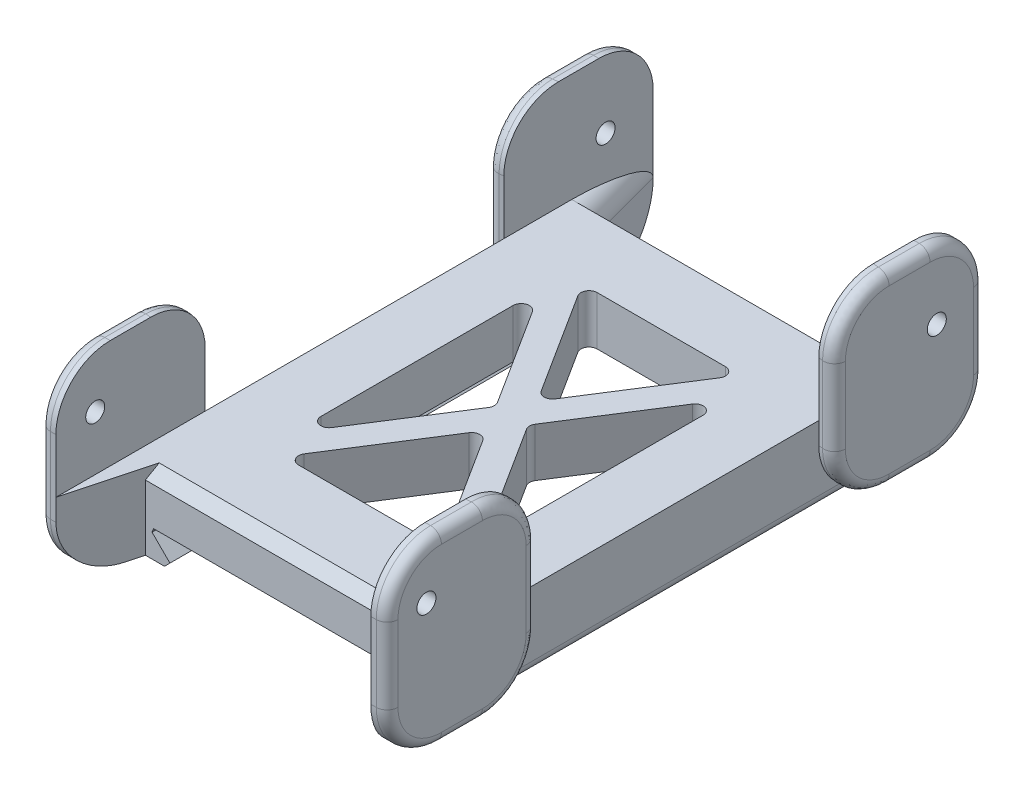
from build123d import *
from OCP.BRepFilletAPI import BRepFilletAPI_MakeChamfer

# Parameters (mm, degrees)
BOSS_EXTRUDE1_DEPTH = 80
CHAMFER1_SIZE       = 2
CHAMFER1_SIZE2      = 1.4142135623730976
BOSS_EXTRUDE2_DEPTH = 4
CHAMFER2_SIZE       = 2
BOSS_EXTRUDE4_START = -14
BOSS_EXTRUDE4_DEPTH = 34
SKETCH8_R           = 1.7500000000000029
SKETCH8_R_2         = 1.749999999999997
CUT_EXTRUDE2_DEPTH  = 117.55899793666725
CUT_EXTRUDE3_DEPTH  = 101.36433629531959
FILLET1_R           = 1.5
FILLET16_R          = 2
CUT_EXTRUDE4_DEPTH  = 20
FILLET17_R          = 10
FILLET18_R          = 2
FILLET19_R          = 4


with BuildPart() as part:
    # Sketch1 → Boss-Extrude1 (new body)
    with BuildSketch(Plane.XY):
        Polygon((-24.292893218813447, -0.7071067811865398), (-24, 0), (24, 0), (24.292893218813447, -0.7071067811865398), (19.99999999999988, -5.000000000000001), (25, -5), (25, 5), (-25, 5), (-25, -5), (-19.99999999999988, -5), align=None)
        Polygon((-29, -5.000000000000001), (-25, -5), (-25, 5), (25, 5), (25, -5), (29, -5.000000000000001), (29, 9.000000000000002), (-29, 9.000000000000002), align=None)
    extrude(amount=BOSS_EXTRUDE1_DEPTH)

    # Chamfer1: one chamfer whose edges measure the first distance from different faces: ONE call of the kernel's chamfer builder (chamfer() names one face for all edges)
    chamfer1_edges_1 = [part.edges().sort_by_distance(p)[0] for p in [
        (19.99999999999988, -5, 40),
    ]]
    chamfer1_side_1 = [part.faces().sort_by_distance(p)[0] for p in [
        (22.146446609406663, -2.8535533905932704, 40),
    ]]
    chamfer1_edges_2 = [part.edges().sort_by_distance(p)[0] for p in [
        (-19.99999999999988, -5, 40),
    ]]
    chamfer1_side_2 = [part.faces().sort_by_distance(p)[0] for p in [
        (-24.49999999999994, -5, 40),
    ]]
    chamfer1 = BRepFilletAPI_MakeChamfer(part.part.solid().wrapped)
    for e in chamfer1_edges_1:
        chamfer1.Add(CHAMFER1_SIZE, CHAMFER1_SIZE2, e.wrapped, chamfer1_side_1[0].wrapped)  # the first distance lies on this face
    for e in chamfer1_edges_2:
        chamfer1.Add(CHAMFER1_SIZE, CHAMFER1_SIZE2, e.wrapped, chamfer1_side_2[0].wrapped)  # the first distance lies on this face
    add(Compound.cast(chamfer1.Shape()), mode=Mode.REPLACE)

    # Sketch3 → Boss-Extrude2 (add)
    with BuildSketch(Plane(origin=(0, 0, 0), x_dir=(-1, 0, 0), z_dir=(0, 0, -1))):
        Polygon((-29, 9.000000000000002), (28.999999999999993, 9.000000000000002), (29, -5.000000000000001), (-29, -5.000000000000001), align=None)
    extrude(amount=BOSS_EXTRUDE2_DEPTH)

    # Chamfer2
    chamfer2_edges = [part.edges().sort_by_distance(p)[0] for p in [
        (0, 9.000000000000002, 80),
        (0, -5.000000000000001, -4),
        (-28.999999999999996, 2, -4),
        (3.55e-15, 9.000000000000002, -4),
    ]]
    chamfer(chamfer2_edges, length=CHAMFER2_SIZE)

    # Sketch6 → Boss-Extrude4 (add)
    with BuildSketch(Plane(origin=(0, 9.000000000000002, 0), x_dir=(1, 0, 0), z_dir=(0, 1, 0)).offset(BOSS_EXTRUDE4_START)):
        Polygon((28.999999999999996, -10.500000000000012), (31.999999999999986, -10.827272727272735), (31.999999999999986, 17), (28.99999999999999, 16.999999999999986), (28.999999999999993, 1.9999999999999858), align=None)
        Polygon((28.999999999999993, 1.9999999999999858), (28.99999999999999, 16.999999999999986), (27.273253634424695, 10.55569483188789), (26.339905107309647, 1.9999999999999911), align=None)
        Polygon((26.339905107309647, 1.9999999999999911), (27.273253634424687, 10.555694831887891), (24.98076211353327, 1.999999999999984), align=None)
        Polygon((-26.33990510730964, 1.999999999999988), (-24.980762113533274, 1.999999999999988), (-27.273253634424673, 10.555694831887777), align=None)
        Polygon((-26.33990510730965, 1.9999999999999876), (-27.273253634424677, 10.555694831887777), (-29, 16.999999999999975), (-29, 1.9999999999999858), align=None)
        Polygon((-29, 1.9999999999999858), (-29, 16.99999999999997), (-31.999999999999986, 16.999999999999993), (-31.999999999999986, -10.827272727272742), (-29, -10.500000000000009), align=None)
        Polygon((27.27325363442468, -86.55569483188785), (26.33990510730965, -78.00000000000004), (24.980762113533288, -78.00000000000004), align=None)
        Polygon((28.99999999999999, -93.00000000000001), (28.999999999999993, -78.00000000000004), (26.339905107309647, -78.00000000000004), (27.27325363442468, -86.55569483188785), align=None)
        Polygon((31.999999999999986, -93.00000000000003), (31.999999999999986, -65.1727272727273), (28.999999999999996, -65.50000000000003), (28.999999999999993, -78.00000000000004), (28.99999999999999, -93.00000000000001), align=None)
        Polygon((-31.999999999999986, -93.00000000000003), (-29, -93), (-29, -78.00000000000004), (-29, -65.50000000000003), (-31.999999999999986, -65.1727272727273), align=None)
        Polygon((-29, -93), (-27.27325363442467, -86.55569483188779), (-26.33990510730965, -78.00000000000004), (-29, -78.00000000000004), align=None)
        Polygon((-27.27325363442467, -86.55569483188779), (-24.98076211353327, -78.00000000000001), (-26.33990510730965, -78.00000000000004), align=None)
    extrude(amount=BOSS_EXTRUDE4_DEPTH)

    # Sketch8 → Cut-Extrude2 (cut, through all)
    with BuildSketch(Plane.ZY.offset(31.999999999999986)):
        with Locations((-8.234822599597958, 16.476421144860893)):
            Circle(SKETCH8_R)
        with Locations((85.76096581557758, 19.000000000000128)):
            Circle(SKETCH8_R_2)
    extrude(amount=-CUT_EXTRUDE2_DEPTH, mode=Mode.SUBTRACT)

    # Sketch9 → Cut-Extrude3 (cut, through all)
    with BuildSketch(Plane(origin=(0, 9.000000000000002, 0), x_dir=(1, 0, 0), z_dir=(0, 1, 0))):
        with BuildLine():
            Line((14.734507768401814, -19.502346653370523), (2.9632738205466698, -38.00000000000003))
            Line((2.963273820546666, -38.00000000000003), (14.734507768401839, -56.49765334662959))
            ThreePointArc((14.734507768401842, -56.49765334662959), (16.419381480637153, -57.132520365703066), (17.50000000000004, -55.69234010833984))
            Line((17.50000000000004, -55.69234010833984), (17.50000000000001, -20.307659891660272))
            ThreePointArc((17.500000000000014, -20.307659891660272), (16.419381480637128, -18.867479634297048), (14.734507768401818, -19.502346653370523))
        make_face()
        with BuildLine():
            Line((13.06970866417807, -63.19468676171028), (1.954e-14, -42.65657314657334))
            Line((5.81e-15, -42.65657314657334), (8.78e-15, -65.50000000000003))
            Line((8.88e-15, -65.50000000000003), (11.804216432579896, -65.50000000000003))
            ThreePointArc((11.804216432579897, -65.50000000000003), (13.119125147554948, -64.72181373724995), (13.069708664178068, -63.19468676171028))
        make_face()
        with BuildLine():
            Line((8.78e-15, -65.50000000000003), (5.81e-15, -42.65657314657334))
            Line((1.066e-14, -42.65657314657335), (-13.06970866417804, -63.19468676171028))
            ThreePointArc((-13.06970866417804, -63.19468676171028), (-13.119125147554922, -64.72181373724995), (-11.804216432579867, -65.50000000000003))
            Line((-11.804216432579867, -65.50000000000003), (8.88e-15, -65.50000000000003))
        make_face()
        with BuildLine():
            Line((-14.734507768401803, -56.49765334662955), (-2.9632738205466413, -38.000000000000014))
            Line((-2.963273820546643, -38.000000000000014), (-14.734507768401798, -19.502346653370488))
            ThreePointArc((-14.734507768401798, -19.502346653370488), (-16.41938148063711, -18.867479634297005), (-17.499999999999996, -20.307659891660236))
            Line((-17.499999999999996, -20.307659891660236), (-17.5, -55.6923401083398))
            ThreePointArc((-17.500000000000004, -55.6923401083398), (-16.419381480637117, -57.13252036570303), (-14.734507768401802, -56.497653346629555))
        make_face()
        with BuildLine():
            Line((4.6e-15, -33.343426853426706), (1.63e-15, -10.50000000000003))
            Line((1.78e-15, -10.50000000000003), (-11.804216432579855, -10.50000000000003))
            ThreePointArc((-11.804216432579855, -10.500000000000028), (-13.119125147554914, -11.278186262750111), (-13.069708664178023, -12.805313238289788))
            Line((-13.069708664178025, -12.805313238289788), (7.11e-15, -33.343426853426706))
        make_face()
        with BuildLine():
            Line((11.804216432579887, -10.50000000000003), (1.78e-15, -10.50000000000003))
            Line((1.63e-15, -10.50000000000003), (4.6e-15, -33.343426853426706))
            Line((1.066e-14, -33.343426853426706), (13.069708664178057, -12.805313238289788))
            ThreePointArc((13.069708664178055, -12.805313238289788), (13.119125147554945, -11.278186262750111), (11.804216432579887, -10.500000000000028))
        make_face()
    extrude(amount=-CUT_EXTRUDE3_DEPTH, mode=Mode.SUBTRACT)

    # Fillet1
    fillet1_edges = [part.edges().sort_by_distance(p)[0] for p in [
        (-2.9632738205466422, 4.500000000000001, 38.000000000000014),
        (1.267e-14, 4.500000000000001, 42.65657314657334),
        (5.85e-15, 4.500000000000001, 33.343426853426706),
        (2.963273820546668, 4.500000000000001, 38.00000000000003),
    ]]
    fillet(fillet1_edges, radius=FILLET1_R)

    # Fillet16
    fillet16_edges = [part.edges().sort_by_distance(p)[0] for p in [
        (29, -5.000000000000001, 38.00000000000002),
        (-29, -5.000000000000001, 38.00000000000002),
    ]]
    fillet(fillet16_edges, radius=FILLET16_R)

    # Sketch11 → Cut-Extrude4 (cut)
    with BuildSketch(Plane(origin=(0, 29, 0), x_dir=(1, 0, 0), z_dir=(0, 1, 0))):
        Polygon((24.98076211353327, 1.9999999999999862), (28.99999999999999, 16.999999999999986), (29, 1.999999999999988), align=None)
        Polygon((-28.999999999999993, 16.999999999999975), (-29, 1.9999999999999805), (-24.98076211353327, 1.9999999999999796), align=None)
        Polygon((-29, -78.00000000000003), (-24.98076211353327, -78.00000000000003), (-28.999999999999993, -93.00000000000001), align=None)
        Polygon((29, -78.00000000000003), (24.98076211353327, -78.00000000000003), (28.99999999999999, -93.00000000000003), align=None)
    extrude(amount=-CUT_EXTRUDE4_DEPTH, mode=Mode.SUBTRACT)

    # Fillet17
    fillet17_edges = [part.edges().sort_by_distance(p)[0] for p in [
        (30.499999999999993, 29, 10.663636363636375),
    ]]
    fillet(fillet17_edges, radius=FILLET17_R)
    fillet17_2_edges = [part.edges().sort_by_distance(p)[0] for p in [
        (29.499999999999993, -5, 10.554545454545467),
    ]]
    fillet(fillet17_2_edges, radius=FILLET17_R)
    fillet17_3_edges = [part.edges().sort_by_distance(p)[0] for p in [
        (29.499999999999993, -5, 65.44545454545458),
    ]]
    fillet(fillet17_3_edges, radius=FILLET17_R)
    fillet17_4_edges = [part.edges().sort_by_distance(p)[0] for p in [
        (30.499999999999986, -4.999999999999998, 93.00000000000001),
    ]]
    fillet(fillet17_4_edges, radius=FILLET17_R)
    fillet17_5_edges = [part.edges().sort_by_distance(p)[0] for p in [
        (-30.499999999999993, -4.999999999999998, 93.00000000000001),
    ]]
    fillet(fillet17_5_edges, radius=FILLET17_R)
    fillet17_6_edges = [part.edges().sort_by_distance(p)[0] for p in [
        (-29.499999999999993, -5, 65.44545454545458),
    ]]
    fillet(fillet17_6_edges, radius=FILLET17_R)
    fillet17_7_edges = [part.edges().sort_by_distance(p)[0] for p in [
        (-29.499999999999993, -5, 10.554545454545467),
    ]]
    fillet(fillet17_7_edges, radius=FILLET17_R)
    fillet17_8_edges = [part.edges().sort_by_distance(p)[0] for p in [
        (-30.499999999999993, -4.999999999999998, -16.999999999999986),
    ]]
    fillet(fillet17_8_edges, radius=FILLET17_R)
    fillet17_9_edges = [part.edges().sort_by_distance(p)[0] for p in [
        (30.499999999999986, -4.999999999999998, -16.99999999999999),
    ]]
    fillet(fillet17_9_edges, radius=FILLET17_R)
    fillet17_10_edges = [part.edges().sort_by_distance(p)[0] for p in [
        (30.499999999999986, 29, -16.99999999999999),
    ]]
    fillet(fillet17_10_edges, radius=FILLET17_R)
    fillet17_11_edges = [part.edges().sort_by_distance(p)[0] for p in [
        (-30.499999999999993, 29, -16.999999999999986),
    ]]
    fillet(fillet17_11_edges, radius=FILLET17_R)
    fillet17_12_edges = [part.edges().sort_by_distance(p)[0] for p in [
        (-30.499999999999993, 29, 10.663636363636371),
    ]]
    fillet(fillet17_12_edges, radius=FILLET17_R)
    fillet17_13_edges = [part.edges().sort_by_distance(p)[0] for p in [
        (-30.499999999999993, 29, 65.33636363636367),
    ]]
    fillet(fillet17_13_edges, radius=FILLET17_R)
    fillet17_14_edges = [part.edges().sort_by_distance(p)[0] for p in [
        (-30.499999999999993, 29, 93.00000000000001),
    ]]
    fillet(fillet17_14_edges, radius=FILLET17_R)
    fillet17_15_edges = [part.edges().sort_by_distance(p)[0] for p in [
        (30.499999999999986, 29, 93.00000000000001),
    ]]
    fillet(fillet17_15_edges, radius=FILLET17_R)
    fillet17_16_edges = [part.edges().sort_by_distance(p)[0] for p in [
        (30.499999999999993, 29, 65.33636363636367),
    ]]
    fillet(fillet17_16_edges, radius=FILLET17_R)

    # Fillet18
    fillet18_edges = [part.edges().sort_by_distance(p)[0] for p in [
        (31.999999999999986, -4.999999999999998, 79.11602770677204),
        (-31.999999999999986, -4.999999999999998, 79.11602770677204),
        (-31.999999999999986, -4.999999999999998, -3.1160277067720124),
        (31.999999999999986, -4.999999999999998, -3.116027706772009),
        (-31.999999999999986, 12.000000000000002, 65.17272727272731),
        (-31.999999999999986, 11.999999999999998, 93.00000000000003),
        (-31.999999999999986, 29, 79.11602770677203),
        (-31.99999999999992, 26.071067811865476, 90.0710678118655),
        (-31.99999999999992, -2.07106781186548, 90.0710678118655),
        (-31.999999999999986, 26.08151678314905, 68.12956278921332),
        (-31.999999999999986, -2.0815167831490466, 68.12956278921334),
        (-31.999999999999986, 12.000000000000005, 10.827272727272739),
        (-31.999999999999986, 11.999999999999998, -16.999999999999996),
        (-31.999999999999986, 29, -3.1160277067720124),
        (-31.999999999999943, -2.07106781186548, -14.071067811865468),
        (-31.999999999999943, 26.071067811865476, -14.07106781186547),
        (-31.999999999999986, 26.081516783149052, 7.870437210786693),
        (-31.999999999999986, -2.081516783149044, 7.8704372107866964),
        (31.999999999999986, 11.999999999999998, -16.999999999999996),
        (31.999999999999986, 29, -3.1160277067720124),
        (31.999999999999986, 12.000000000000002, 10.827272727272739),
        (31.999999999999986, -2.0815167831490404, 7.870437210786703),
        (31.999999999999986, 26.081516783149045, 7.8704372107866964),
        (31.999999999999968, 26.071067811865476, -14.07106781186547),
        (31.999999999999968, -2.07106781186548, -14.071067811865468),
        (31.999999999999986, 12.000000000000002, 65.1727272727273),
        (31.999999999999986, 11.999999999999998, 93.00000000000003),
        (31.999999999999986, 29, 79.11602770677204),
        (31.999999999999954, -2.07106781186548, 90.0710678118655),
        (31.999999999999954, 26.071067811865476, 90.07106781186549),
        (31.999999999999986, 26.081516783149052, 68.12956278921334),
        (31.999999999999986, -2.0815167831490484, 68.12956278921334),
    ]]
    fillet(fillet18_edges, radius=FILLET18_R)

    # Fillet19
    # the kernel refuses this fillet: 4 mm, written as the material it takes off along each edge
    with BuildSketch(Plane(origin=(-22.39257166250813, 9.000000000000002, 7.659258262890722), x_dir=(0, -1, 0), z_dir=(-0.25881904510251375, 0, -0.9659258262890702))) as fillet19_piece_1_section:
        with BuildLine():
            CenterArc((FILLET19_R, FILLET19_R), FILLET19_R, 180, 90)
            Line((0, FILLET19_R), (0, 0))
            Line((0, 0), (FILLET19_R, 0))
        make_face()
    fillet19_piece_1 = extrude(amount=35.52914270615121, mode=Mode.PRIVATE)
    fillet19_piece_1 = split(fillet19_piece_1, bisect_by=Plane(origin=(-26.529713287469157, 8.572136307603804, -4), z_dir=(0, 0, 1)), keep=Keep.TOP, mode=Mode.PRIVATE)
    fillet19_piece_1 = split(fillet19_piece_1, bisect_by=Plane(origin=(-26.529713287469157, 8.181003023092781, -2.8189969769072194), z_dir=(0, 0.7071067811865476, -0.7071067811865476)), keep=Keep.TOP, mode=Mode.PRIVATE)
    fillet19_piece_1 = split(fillet19_piece_1, bisect_by=Plane(origin=(-29, 8.572136307603804, -3.210130261418243), z_dir=(1, 0, 0)), keep=Keep.TOP, mode=Mode.PRIVATE)
    add(fillet19_piece_1, mode=Mode.SUBTRACT)
    with BuildSketch(Plane(origin=(-22.39257166250813, 9.000000000000002, 7.659258262890722), x_dir=(0, -1, 0), z_dir=(-0.25881904510251375, 0, -0.9659258262890702))) as fillet19_piece_2_section:
        with BuildLine():
            CenterArc((FILLET19_R, FILLET19_R), FILLET19_R, 180, 90)
            Line((0, FILLET19_R), (0, 0))
            Line((0, 0), (FILLET19_R, 0))
        make_face()
    fillet19_piece_2 = extrude(amount=35.52914270615121, mode=Mode.PRIVATE)
    fillet19_piece_2 = split(fillet19_piece_2, bisect_by=Plane(origin=(-25.69390634564033, 5.945523905477076, -4), z_dir=(0, 0, -1)), keep=Keep.TOP, mode=Mode.PRIVATE)
    fillet19_piece_2 = split(fillet19_piece_2, bisect_by=Plane(origin=(-25.69390634564033, 6.2091429290460916, -4.79085707095391), z_dir=(0, -0.7071067811865476, 0.7071067811865476)), keep=Keep.TOP, mode=Mode.PRIVATE)
    add(fillet19_piece_2, mode=Mode.SUBTRACT)
    with BuildSketch(Plane(origin=(-22.39257166250813, 9.000000000000002, 7.659258262890722), x_dir=(0, -1, 0), z_dir=(-0.25881904510251375, 0, -0.9659258262890702))) as fillet19_piece_3_section:
        with BuildLine():
            CenterArc((FILLET19_R, FILLET19_R), FILLET19_R, 180, 90)
            Line((0, FILLET19_R), (0, 0))
            Line((0, 0), (FILLET19_R, 0))
        make_face()
    fillet19_piece_3 = extrude(amount=35.52914270615121, mode=Mode.PRIVATE)
    fillet19_piece_3 = split(fillet19_piece_3, bisect_by=Plane(origin=(-27.58963672929719, 7.934721799923489, -4), z_dir=(0, 0, -1)), keep=Keep.TOP, mode=Mode.PRIVATE)
    fillet19_piece_3 = split(fillet19_piece_3, bisect_by=Plane(origin=(-27.58963672929719, 4.784795549682256, -6.215204450317746), z_dir=(0, 0.7071067811865476, -0.7071067811865476)), keep=Keep.TOP, mode=Mode.PRIVATE)
    fillet19_piece_3 = split(fillet19_piece_3, bisect_by=Plane(origin=(-29, 7.934721799923489, -9.365130700558979), z_dir=(1, 0, 0)), keep=Keep.TOP, mode=Mode.PRIVATE)
    add(fillet19_piece_3, mode=Mode.SUBTRACT)
    with BuildSketch(Plane(origin=(22.392571662508136, 9.000000000000002, 7.659258262890717), x_dir=(-2.2e-16, -1, -6e-17), z_dir=(0.2588190451025135, 0, -0.9659258262890703))) as fillet19_piece_4_section:
        with BuildLine():
            CenterArc((FILLET19_R, -FILLET19_R), FILLET19_R, 89.99999999999999, 90.00000000000001)
            Line((-9.2e-16, -FILLET19_R), (0, 0))
            Line((0, 0), (FILLET19_R, 0))
        make_face()
    fillet19_piece_4 = extrude(amount=35.52914270615122, mode=Mode.PRIVATE)
    fillet19_piece_4 = split(fillet19_piece_4, bisect_by=Plane(origin=(26.529713287469058, 8.572136307603653, -4), z_dir=(0, 0, 1)), keep=Keep.TOP, mode=Mode.PRIVATE)
    fillet19_piece_4 = split(fillet19_piece_4, bisect_by=Plane(origin=(26.529713287469058, 8.181003023092652, -2.8189969769073504), z_dir=(0, 0.7071067811865476, -0.7071067811865476)), keep=Keep.TOP, mode=Mode.PRIVATE)
    fillet19_piece_4 = split(fillet19_piece_4, bisect_by=Plane(origin=(28.999999999999993, 8.572136307603653, -3.210130261418355), z_dir=(-1, 0, 2.4e-16)), keep=Keep.TOP, mode=Mode.PRIVATE)
    add(fillet19_piece_4, mode=Mode.SUBTRACT)
    with BuildSketch(Plane(origin=(22.392571662508136, 9.000000000000002, 7.659258262890717), x_dir=(-2.2e-16, -1, -6e-17), z_dir=(0.2588190451025135, 0, -0.9659258262890703))) as fillet19_piece_5_section:
        with BuildLine():
            CenterArc((FILLET19_R, -FILLET19_R), FILLET19_R, 89.99999999999999, 90.00000000000001)
            Line((-9.2e-16, -FILLET19_R), (0, 0))
            Line((0, 0), (FILLET19_R, 0))
        make_face()
    fillet19_piece_5 = extrude(amount=35.52914270615122, mode=Mode.PRIVATE)
    fillet19_piece_5 = split(fillet19_piece_5, bisect_by=Plane(origin=(25.69390634564039, 5.945523905477316, -4), z_dir=(0, 0, -1)), keep=Keep.TOP, mode=Mode.PRIVATE)
    fillet19_piece_5 = split(fillet19_piece_5, bisect_by=Plane(origin=(25.69390634564039, 6.209142929046457, -4.790857070953545), z_dir=(0, -0.7071067811865476, 0.7071067811865476)), keep=Keep.TOP, mode=Mode.PRIVATE)
    add(fillet19_piece_5, mode=Mode.SUBTRACT)
    with BuildSketch(Plane(origin=(22.392571662508136, 9.000000000000002, 7.659258262890717), x_dir=(-2.2e-16, -1, -6e-17), z_dir=(0.2588190451025135, 0, -0.9659258262890703))) as fillet19_piece_6_section:
        with BuildLine():
            CenterArc((FILLET19_R, -FILLET19_R), FILLET19_R, 89.99999999999999, 90.00000000000001)
            Line((-9.2e-16, -FILLET19_R), (0, 0))
            Line((0, 0), (FILLET19_R, 0))
        make_face()
    fillet19_piece_6 = extrude(amount=35.52914270615122, mode=Mode.PRIVATE)
    fillet19_piece_6 = split(fillet19_piece_6, bisect_by=Plane(origin=(27.589636729297233, 7.934721799923679, -4), z_dir=(0, 0, -1)), keep=Keep.TOP, mode=Mode.PRIVATE)
    fillet19_piece_6 = split(fillet19_piece_6, bisect_by=Plane(origin=(27.589636729297233, 4.7847955496823165, -6.215204450317685), z_dir=(0, 0.7071067811865476, -0.7071067811865476)), keep=Keep.TOP, mode=Mode.PRIVATE)
    fillet19_piece_6 = split(fillet19_piece_6, bisect_by=Plane(origin=(28.999999999999993, 7.934721799923679, -9.365130700559046), z_dir=(-1, 0, 2.4e-16)), keep=Keep.TOP, mode=Mode.PRIVATE)
    add(fillet19_piece_6, mode=Mode.SUBTRACT)


solid = part.part
